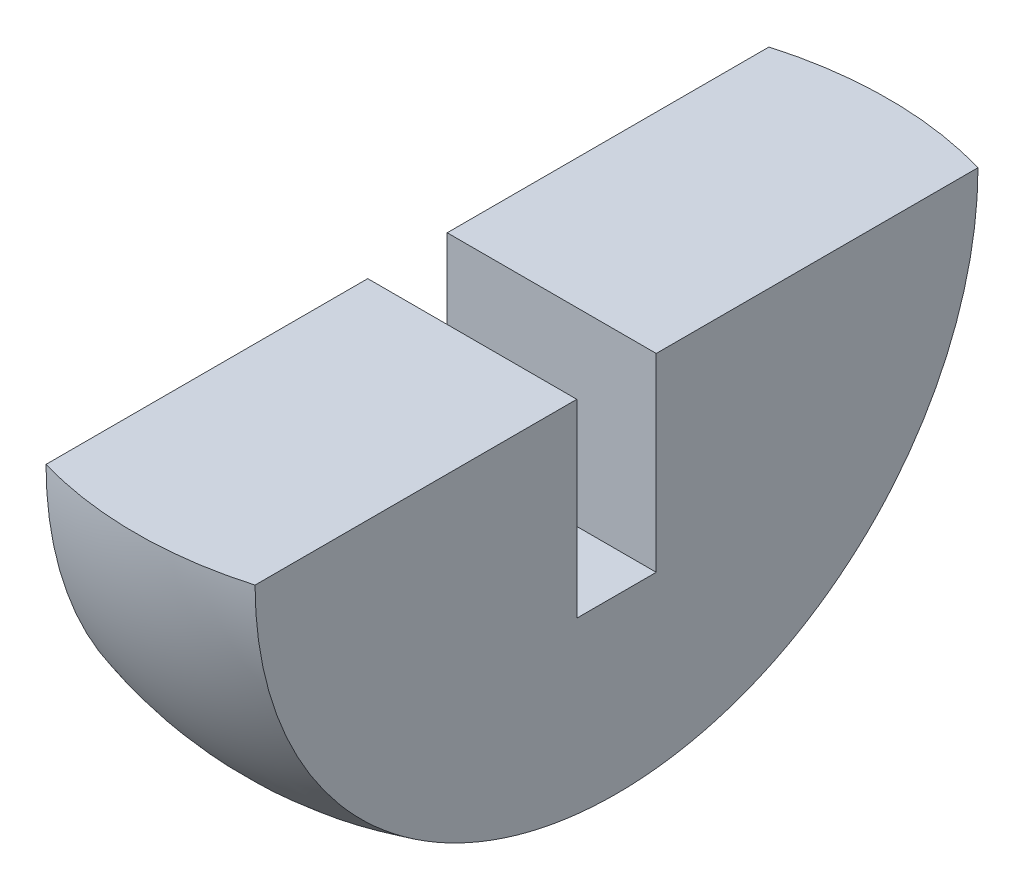
from build123d import *

# Parameters (mm, degrees)
CUT_EXTRUDE2_DEPTH = 331.681115276
SKETCH3_W          = 75
SKETCH3_H          = 28.5
CUT_EXTRUDE3_DEPTH = 68


with BuildPart() as part:
    # Sketch1 → Revolve2 (revolve)
    with BuildSketch(Plane.XY):
        with BuildLine():
            Line((135, 0), (0, 0))
            Line((0, 0), (0, -135))
            ThreePointArc((0, -135), (95.45941546, -95.45941546), (135, 0))
        make_face()
    revolve(axis=Axis((0, 0, 0), (0, 1, 0)))

    # Sketch2 → Cut-Extrude2 (cut, through all)
    with BuildSketch(Plane.XY.offset(135)):
        with BuildLine():
            Line((-37.5, -129.687123493), (-37.5, 0))
            Line((-37.5, 0), (0, 0))
            Line((0, 0), (37.5, 0))
            Line((37.5, 0), (37.5, -129.687123493))
            ThreePointArc((37.5, -129.687123493), (107.906209275, -81.124903698), (135, 0))
            ThreePointArc((135, 0), (-81.124903698, 107.906209275), (-37.5, -129.687123493))
        make_face()
    extrude(amount=-CUT_EXTRUDE2_DEPTH, mode=Mode.SUBTRACT)

    # Sketch3 → Cut-Extrude3 (cut)
    with BuildSketch(Plane(origin=(0, 0, 0), x_dir=(1, 0, 0), z_dir=(0, 1, 0))):
        Rectangle(SKETCH3_W, SKETCH3_H)
    extrude(amount=-CUT_EXTRUDE3_DEPTH, mode=Mode.SUBTRACT)


solid = part.part
